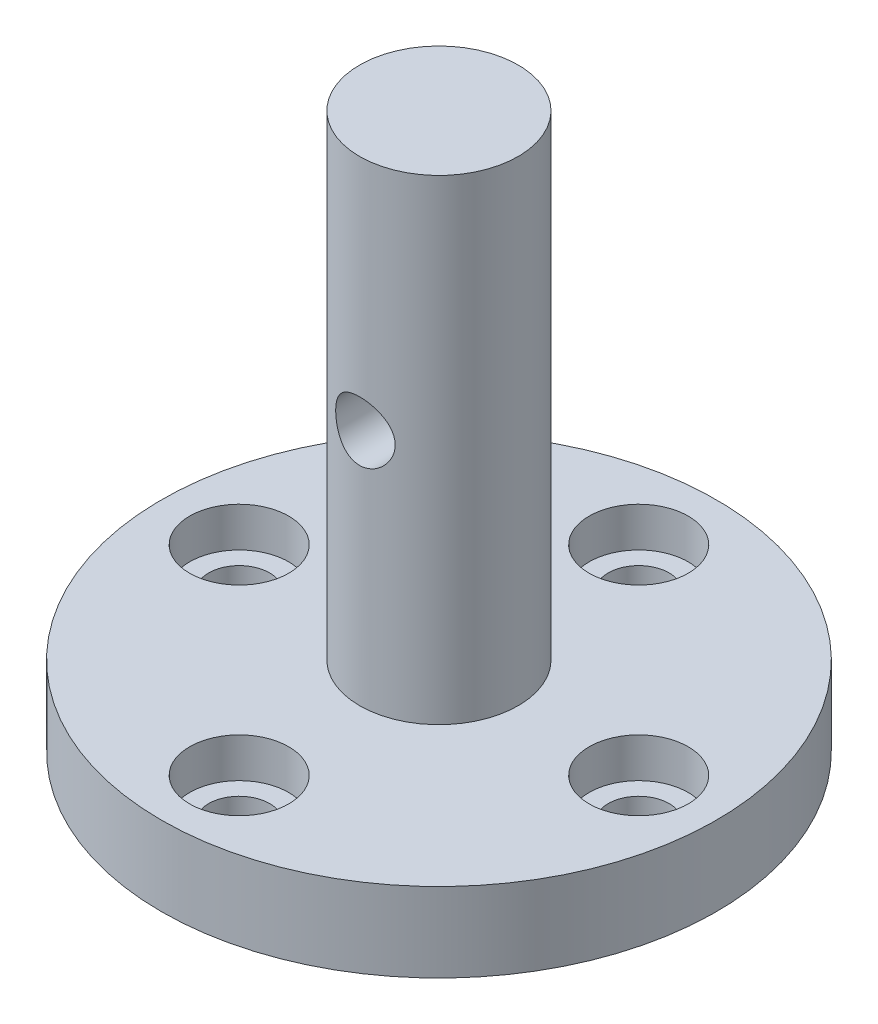
from build123d import *

# Parameters (mm, degrees)
SKETCH1_R                       = 11.1125
BOSS_EXTRUDE1_DEPTH             = 3.175
SKETCH2_R                       = 3.175
BOSS_EXTRUDE2_DEPTH             = 19.05
F_2_CLEARANCE_HOLE1_D           = 2.4384
SKETCH5_R                       = 1.984375
CUT_EXTRUDE1_DEPTH              = 1.5875
F_3_32_0_09375_DIAMETER_HOLE1_D = 2.38125


with BuildPart() as part:
    # Sketch1 → Boss-Extrude1 (new body)
    with BuildSketch(Plane(origin=(0, 0, 0), x_dir=(1, 0, 0), z_dir=(0, 1, 0))):
        Circle(SKETCH1_R)
    extrude(amount=BOSS_EXTRUDE1_DEPTH)

    # Sketch2 → Boss-Extrude2 (add)
    with BuildSketch(Plane(origin=(0, 3.175, 0), x_dir=(1, 0, 0), z_dir=(0, 1, 0))):
        Circle(SKETCH2_R)
    extrude(amount=BOSS_EXTRUDE2_DEPTH)

    # #2 Clearance Hole1 (through all)
    with Locations(Plane(origin=(0, 3.175, 0), x_dir=(1, 0, 0), z_dir=(0, 1, 0))):
        with Locations((0, -8), (0, 8), (-8, 0), (8, 0)):
            Hole(F_2_CLEARANCE_HOLE1_D / 2)

    # Sketch5 → Cut-Extrude1 (cut)
    with BuildSketch(Plane(origin=(0, 3.175, 0), x_dir=(1, 0, 0), z_dir=(0, 1, 0))):
        with Locations((0, -8)):
            Circle(SKETCH5_R)
        with Locations((8, 0)):
            Circle(SKETCH5_R)
        with Locations((0, 8)):
            Circle(SKETCH5_R)
        with Locations((-8, 0)):
            Circle(SKETCH5_R)
    extrude(amount=-CUT_EXTRUDE1_DEPTH, mode=Mode.SUBTRACT)

    # 3/32 (0.09375) Diameter Hole1 (through all)
    with Locations(Plane.XY.offset(3.175)):
        with Locations((0, 12.7)):
            Hole(F_3_32_0_09375_DIAMETER_HOLE1_D / 2)


solid = part.part
